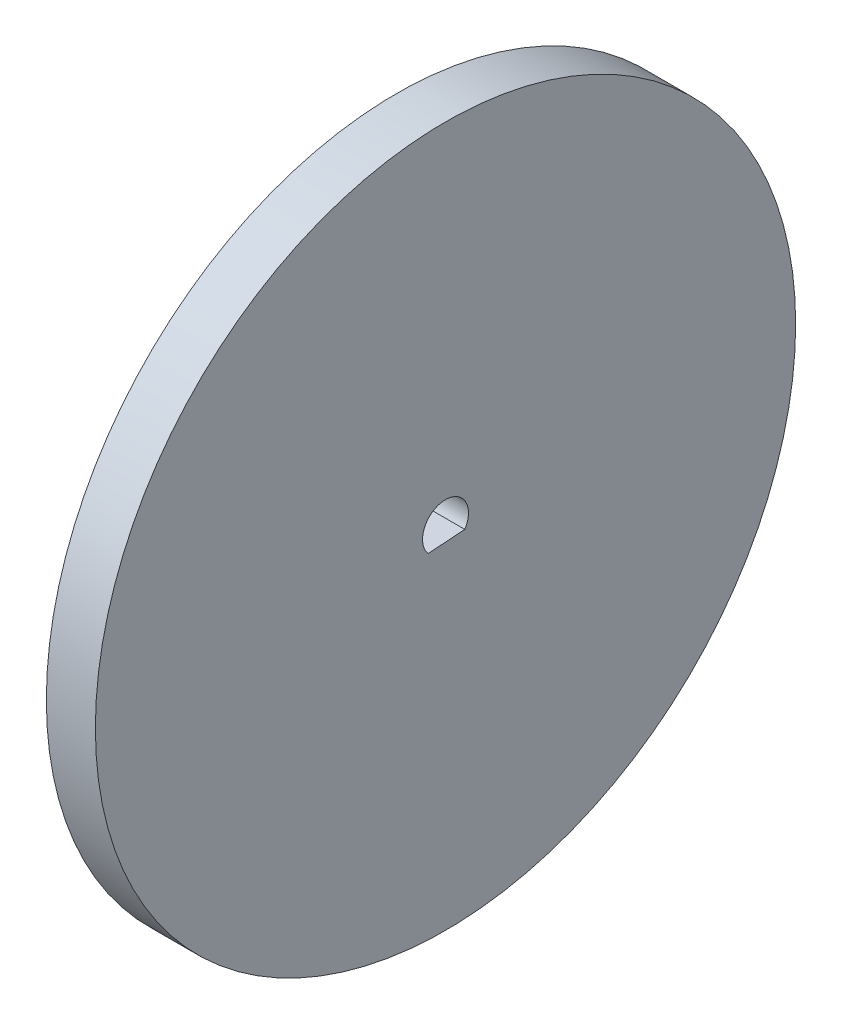
from build123d import *

# Parameters (mm, degrees)
SKETCH1_R           = 38.1
BOSS_EXTRUDE1_DEPTH = 5.334
CUT_EXTRUDE1_DEPTH  = 55.144912559


with BuildPart() as part:
    # Sketch1 → Boss-Extrude1 (new body)
    with BuildSketch(Plane(origin=(0, 0, 0), x_dir=(0, 0, -1), z_dir=(1, 0, 0))):
        Circle(SKETCH1_R)
    extrude(amount=BOSS_EXTRUDE1_DEPTH)

    # Sketch5 → Cut-Extrude1 (cut, through all)
    with BuildSketch(Plane(origin=(5.334, 0, 0), x_dir=(0, 0, -1), z_dir=(1, 0, 0))):
        with BuildLine():
            Line((-1.889315824, -1.637218897), (2.100738572, -1.3553219))
            ThreePointArc((2.100738572, -1.3553219), (-0.176185623, 2.493783998), (-1.889315824, -1.637218897))
        make_face()
    extrude(amount=-CUT_EXTRUDE1_DEPTH, mode=Mode.SUBTRACT)


solid = part.part
